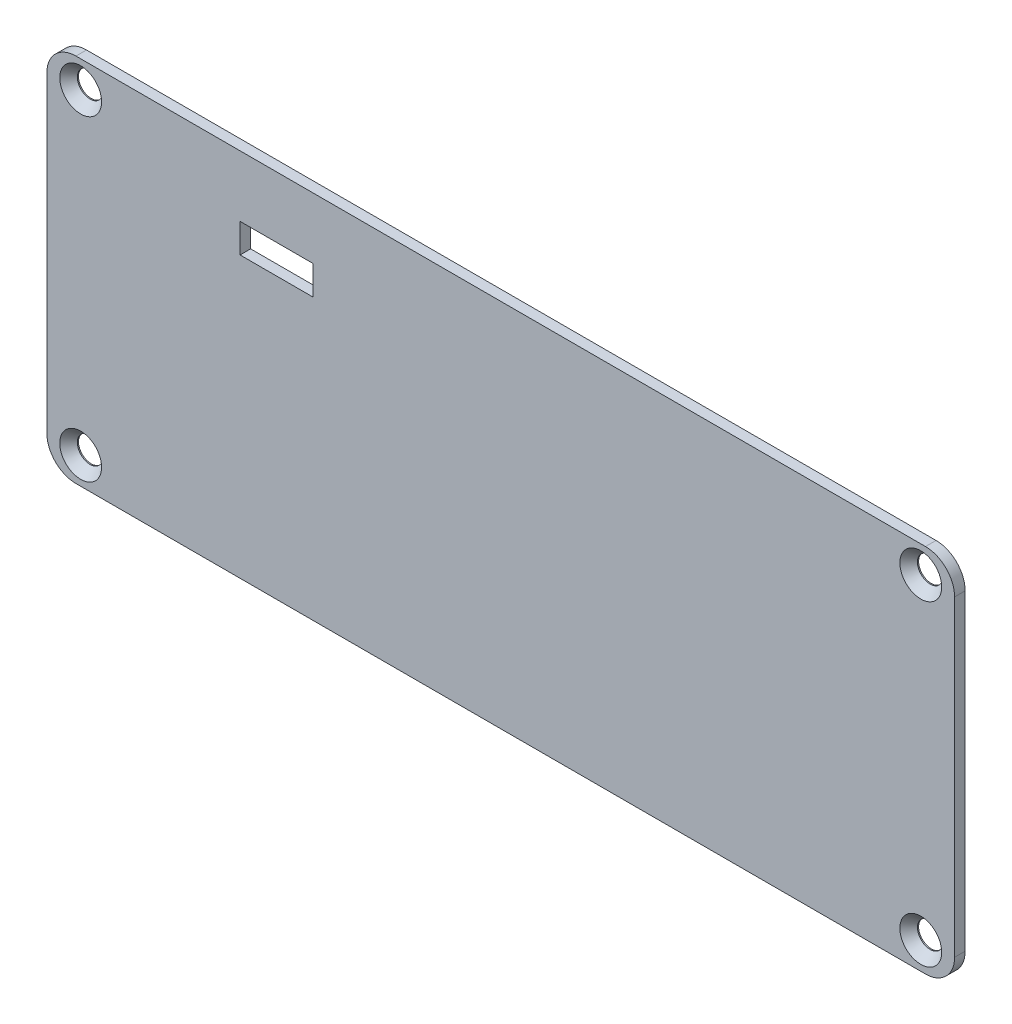
from build123d import *

# Parameters (mm, degrees)
SKETCH1_W                                      = 124.8
SKETCH1_H                                      = 50.9
SKETCH1_W_2                                    = 10
SKETCH1_H_2                                    = 4
BOSS_EXTRUDE1_DEPTH                            = 1.45
CSK_FOR_M3_5_FLAT_HEAD_MACHINE_SCREW1_AT_COUNT = 2
CSK_FOR_M3_5_FLAT_HEAD_MACHINE_SCREW1_AT_PITCH = 115.5
CSK_FOR_M3_5_FLAT_HEAD_MACHINE_SCREW_2_COUNT   = 2
CSK_FOR_M3_5_FLAT_HEAD_MACHINE_SCREW_2_PITCH   = 123.420014584
CSK_FOR_M3_5_FLAT_HEAD_MACHINE_SCREW_3_COUNT   = 2
CSK_FOR_M3_5_FLAT_HEAD_MACHINE_SCREW_3_PITCH   = 43.5
FILLET2_R                                      = 4


with BuildPart() as part:
    # Sketch1 → Boss-Extrude1 (new body)
    with BuildSketch(Plane.XY):
        with Locations((62.4, -25.45)):
            Rectangle(SKETCH1_W, SKETCH1_H)
        with Locations((31.565, -10.4)):
            Rectangle(SKETCH1_W_2, SKETCH1_H_2, mode=Mode.SUBTRACT)
    extrude(amount=BOSS_EXTRUDE1_DEPTH)

    # Sketch2 → CSK for M3.5 Flat Head Machine Screw1 (revolve, cut)
    with BuildSketch(Plane(origin=(4.65, -3.7, 1.45), x_dir=(0, -1, 0), z_dir=(1, 0, 0))):
        Polygon((0, 0), (0, 1.45), (1.75, 1.45), (1.75, 1.294164458), (2.875, 0), align=None)
    csk_for_m3_5_flat_head_machine_screw1 = revolve(axis=Axis((4.65, -3.7, 7.8), (0, 0, -1)), mode=Mode.SUBTRACT)

    # CSK for M3.5 Flat Head Machine Screw1 at: CSK for M3.5 Flat Head Machine Screw1 ×2
    with Locations(*[(i * CSK_FOR_M3_5_FLAT_HEAD_MACHINE_SCREW1_AT_PITCH, 0, 0) for i in range(1, CSK_FOR_M3_5_FLAT_HEAD_MACHINE_SCREW1_AT_COUNT)]):
        add(csk_for_m3_5_flat_head_machine_screw1, mode=Mode.SUBTRACT)

    # CSK for M3.5 Flat Head Machine Screw 2: CSK for M3.5 Flat Head Machine Screw1 ×2
    with Locations(*[Vector(0.9358287664199494, -0.3524549899503705, 0) * (i * CSK_FOR_M3_5_FLAT_HEAD_MACHINE_SCREW_2_PITCH) for i in range(1, CSK_FOR_M3_5_FLAT_HEAD_MACHINE_SCREW_2_COUNT)]):
        add(csk_for_m3_5_flat_head_machine_screw1, mode=Mode.SUBTRACT)

    # CSK for M3.5 Flat Head Machine Screw 3: CSK for M3.5 Flat Head Machine Screw1 ×2
    with Locations(*[(0, -i * CSK_FOR_M3_5_FLAT_HEAD_MACHINE_SCREW_3_PITCH, 0) for i in range(1, CSK_FOR_M3_5_FLAT_HEAD_MACHINE_SCREW_3_COUNT)]):
        add(csk_for_m3_5_flat_head_machine_screw1, mode=Mode.SUBTRACT)

    # Fillet2
    fillet2_edges = [part.edges().sort_by_distance(p)[0] for p in [
        (0, 0, 0.725),
        (124.8, 0, 0.725),
        (124.8, -50.9, 0.725),
        (0, -50.9, 0.725),
    ]]
    fillet(fillet2_edges, radius=FILLET2_R)


solid = part.part
